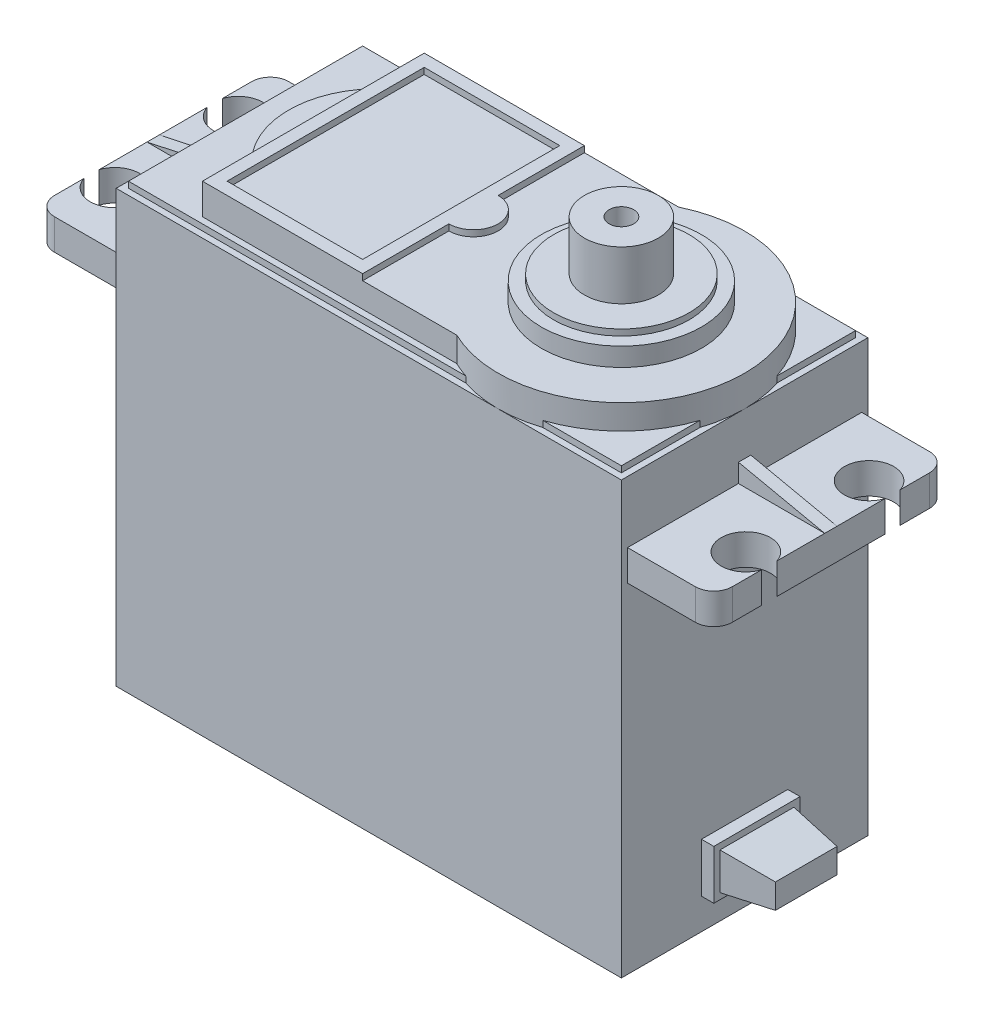
from build123d import *

# Parameters (mm, degrees)
SKETCH1_W            = 41
SKETCH1_H            = 20
BOSS_EXTRUDE1_DEPTH  = 40
CHAMFER1_SIZE        = 2
SKETCH2_R            = 2.25
CUT_EXTRUDE1_DEPTH   = 1
SKETCH3_W            = 19
SKETCH3_H            = 2.5
BOSS_EXTRUDE2_DEPTH  = 7
FILLET1_R            = 1.5
SKETCH4_W            = 7
SKETCH4_H            = 1
BOSS_EXTRUDE3_DEPTH  = 1.5
CUT_EXTRUDE2_DEPTH   = 1
SKETCH6_R            = 2
CUT_EXTRUDE3_DEPTH   = 2.5
FILLET1_OF_MIRROR1_R = 1.5
SKETCH7_W            = 41
SKETCH7_H            = 20
CUT_EXTRUDE4_DEPTH   = 3
SKETCH8_W            = 40
SKETCH8_H            = 19
BOSS_EXTRUDE4_DEPTH  = 0.5
BOSS_EXTRUDE6_DEPTH  = 2.5
SKETCH10_W           = 11
SKETCH10_H           = 16
BOSS_EXTRUDE7_DEPTH  = 0.5
SKETCH11_R           = 6.5
BOSS_EXTRUDE8_DEPTH  = 1.5
SKETCH12_R           = 5.5
BOSS_EXTRUDE9_DEPTH  = 0.5
SKETCH13_R           = 3
BOSS_EXTRUDE10_DEPTH = 4
SKETCH14_R           = 1
CUT_EXTRUDE5_DEPTH   = 8
SKETCH15_W           = 7
SKETCH15_H           = 4
BOSS_EXTRUDE11_DEPTH = 5
SKETCH16_W           = 7
SKETCH16_H           = 4
SKETCH16_W_2         = 6
SKETCH16_H_2         = 3
CUT_EXTRUDE6_DEPTH   = 4
CUT_EXTRUDE7_DEPTH   = 3
CUT_EXTRUDE8_DEPTH   = 7


with BuildPart() as part:
    # Sketch1 → Boss-Extrude1 (new body)
    with BuildSketch(Plane(origin=(0, 0, 0), x_dir=(1, 0, 0), z_dir=(0, 1, 0))):
        Rectangle(SKETCH1_W, SKETCH1_H)
    extrude(amount=BOSS_EXTRUDE1_DEPTH)

    # Chamfer1
    chamfer1_edges = [part.edges().sort_by_distance(p)[0] for p in [
        (20.5, 0, 0),
        (0, 0, -10),
        (-20.5, 0, 0),
        (0, 0, 10),
    ]]
    chamfer(chamfer1_edges, length=CHAMFER1_SIZE)

    # Sketch2 → Cut-Extrude1 (cut)
    with BuildSketch(Plane.XZ):
        with Locations((18.25, 7.75)):
            Circle(SKETCH2_R)
        with Locations((-18.25, 7.75)):
            Circle(SKETCH2_R)
        with Locations((-18.25, -7.75)):
            Circle(SKETCH2_R)
        with Locations((18.25, -7.75)):
            Circle(SKETCH2_R)
    extrude(amount=-CUT_EXTRUDE1_DEPTH, mode=Mode.SUBTRACT)

    # Sketch3 → Boss-Extrude2 (add)
    with BuildSketch(Plane(origin=(20.5, 0, 0), x_dir=(0, 0, -1), z_dir=(1, 0, 0))):
        with Locations((0, 30.75)):
            Rectangle(SKETCH3_W, SKETCH3_H)
    boss_extrude2 = extrude(amount=BOSS_EXTRUDE2_DEPTH)

    # Fillet1
    fillet1_edges = [part.edges().sort_by_distance(p)[0] for p in [
        (27.5, 30.75, -9.5),
        (27.5, 30.75, 9.5),
    ]]
    fillet(fillet1_edges, radius=FILLET1_R)

    # Sketch4 → Boss-Extrude3 (add)
    with BuildSketch(Plane(origin=(0, 32, 0), x_dir=(1, 0, 0), z_dir=(0, 1, 0))):
        with Locations((24, 0)):
            Rectangle(SKETCH4_W, SKETCH4_H)
    boss_extrude3 = extrude(amount=BOSS_EXTRUDE3_DEPTH)

    # Sketch5 → Cut-Extrude2 (cut)
    with BuildSketch(Plane.XY.offset(0.5)):
        Polygon((27.5, 33.5), (27.5, 32), (20.5, 33.5), align=None)
    cut_extrude2 = extrude(amount=-CUT_EXTRUDE2_DEPTH, mode=Mode.SUBTRACT)

    # Sketch6 → Cut-Extrude3 (cut)
    with BuildSketch(Plane(origin=(0, 32, 0), x_dir=(1, 0, 0), z_dir=(0, 1, 0))):
        with Locations((25.6, 5)):
            Circle(SKETCH6_R)
        with Locations((25.6, -5)):
            Circle(SKETCH6_R)
    cut_extrude3 = extrude(amount=-CUT_EXTRUDE3_DEPTH, mode=Mode.SUBTRACT)

    # Mirror1: Boss-Extrude2, Boss-Extrude3, Cut-Extrude2, Cut-Extrude3 across plane
    add(boss_extrude2.mirror(Plane(origin=(0, 0, 0), x_dir=(0, 0, 1), z_dir=(1, 0, 0))))
    add(boss_extrude3.mirror(Plane(origin=(0, 0, 0), x_dir=(0, 0, 1), z_dir=(1, 0, 0))))
    add(cut_extrude2.mirror(Plane(origin=(0, 0, 0), x_dir=(0, 0, 1), z_dir=(1, 0, 0))), mode=Mode.SUBTRACT)
    add(cut_extrude3.mirror(Plane(origin=(0, 0, 0), x_dir=(0, 0, 1), z_dir=(1, 0, 0))), mode=Mode.SUBTRACT)

    # Fillet1 of Mirror1
    fillet1_of_mirror1_edges = [part.edges().sort_by_distance(p)[0] for p in [
        (-27.5, 30.75, -9.5),
        (-27.5, 30.75, 9.5),
    ]]
    fillet(fillet1_of_mirror1_edges, radius=FILLET1_OF_MIRROR1_R)

    # Sketch7 → Cut-Extrude4 (cut)
    with BuildSketch(Plane(origin=(0, 40, 0), x_dir=(1, 0, 0), z_dir=(0, 1, 0))):
        Rectangle(SKETCH7_W, SKETCH7_H)
    extrude(amount=-CUT_EXTRUDE4_DEPTH, mode=Mode.SUBTRACT)

    # Sketch8 → Boss-Extrude4 (add)
    with BuildSketch(Plane(origin=(0, 37, 0), x_dir=(1, 0, 0), z_dir=(0, 1, 0))):
        Rectangle(SKETCH8_W, SKETCH8_H)
    extrude(amount=BOSS_EXTRUDE4_DEPTH)

    # Sketch9 → Boss-Extrude6 (add)
    with BuildSketch(Plane(origin=(0, 37, 0), x_dir=(1, 0, 0), z_dir=(0, 1, 0))):
        with BuildLine():
            Line((6.141101056, 9), (-14.5, 9))
            Line((-14.5, 9), (-14.5, 5))
            ThreePointArc((-14.5, 5), (-16.5, 0), (-14.5, -5))
            Line((-14.5, -5), (-14.5, -9))
            Line((-14.5, -9), (6.141101056, -9))
            ThreePointArc((6.141101056, -9), (20.5, 0), (6.141101056, 9))
        make_face()
    extrude(amount=BOSS_EXTRUDE6_DEPTH)

    # Sketch10 → Boss-Extrude7 (add)
    with BuildSketch(Plane(origin=(0, 39.5, 0), x_dir=(1, 0, 0), z_dir=(0, 1, 0))):
        with BuildLine():
            Line((-14.5, 9), (-1.5, 9))
            Line((-1.5, 9), (-1.5, 2))
            ThreePointArc((-1.5, 2), (0.5, 0), (-1.5, -2))
            Line((-1.5, -2), (-1.5, -9))
            Line((-1.5, -9), (-14.5, -9))
            Line((-14.5, -9), (-14.5, 9))
        make_face()
        with Locations((-8, 0)):
            Rectangle(SKETCH10_W, SKETCH10_H, mode=Mode.SUBTRACT)
    extrude(amount=BOSS_EXTRUDE7_DEPTH)

    # Sketch11 → Boss-Extrude8 (add)
    with BuildSketch(Plane(origin=(0, 39.5, 0), x_dir=(1, 0, 0), z_dir=(0, 1, 0))):
        with Locations((10.5, 0)):
            Circle(SKETCH11_R)
    extrude(amount=BOSS_EXTRUDE8_DEPTH)

    # Sketch12 → Boss-Extrude9 (add)
    with BuildSketch(Plane(origin=(0, 41, 0), x_dir=(1, 0, 0), z_dir=(0, 1, 0))):
        with Locations((10.5, 0)):
            Circle(SKETCH12_R)
    extrude(amount=BOSS_EXTRUDE9_DEPTH)

    # Sketch13 → Boss-Extrude10 (add)
    with BuildSketch(Plane(origin=(0, 41.5, 0), x_dir=(1, 0, 0), z_dir=(0, 1, 0))):
        with Locations((10.5, 0)):
            Circle(SKETCH13_R)
    extrude(amount=BOSS_EXTRUDE10_DEPTH)

    # Sketch14 → Cut-Extrude5 (cut)
    with BuildSketch(Plane(origin=(0, 45.5, 0), x_dir=(1, 0, 0), z_dir=(0, 1, 0))):
        with Locations((10.5, 0)):
            Circle(SKETCH14_R)
    extrude(amount=-CUT_EXTRUDE5_DEPTH, mode=Mode.SUBTRACT)

    # Sketch15 → Boss-Extrude11 (add)
    with BuildSketch(Plane(origin=(20.5, 0, 0), x_dir=(0, 0, -1), z_dir=(1, 0, 0))):
        with Locations((0, 6.5)):
            Rectangle(SKETCH15_W, SKETCH15_H)
    extrude(amount=BOSS_EXTRUDE11_DEPTH)

    # Sketch16 → Cut-Extrude6 (cut)
    with BuildSketch(Plane(origin=(25.5, 0, 0), x_dir=(0, 0, -1), z_dir=(1, 0, 0))):
        with Locations((0, 6.5)):
            Rectangle(SKETCH16_W, SKETCH16_H)
        with Locations((0, 6.5)):
            Rectangle(SKETCH16_W_2, SKETCH16_H_2, mode=Mode.SUBTRACT)
    extrude(amount=-CUT_EXTRUDE6_DEPTH, mode=Mode.SUBTRACT)

    # Sketch17 → Cut-Extrude7 (cut)
    with BuildSketch(Plane.XZ.offset(-5)):
        Polygon((21.5, 3), (25.5, 2.5), (25.5, 3), align=None)
        Polygon((21.5, -3), (25.5, -2.5), (25.5, -3), align=None)
    extrude(amount=-CUT_EXTRUDE7_DEPTH, mode=Mode.SUBTRACT)

    # Sketch18 → Cut-Extrude8 (cut)
    with BuildSketch(Plane(origin=(0, 0, -3.5), x_dir=(-1, 0, 0), z_dir=(0, 0, -1))):
        Polygon((-21.5, 8), (-25.5, 8), (-25.5, 7.5), align=None)
        Polygon((-21.5, 5), (-25.5, 5), (-25.5, 5.5), align=None)
    extrude(amount=-CUT_EXTRUDE8_DEPTH, mode=Mode.SUBTRACT)


solid = part.part
